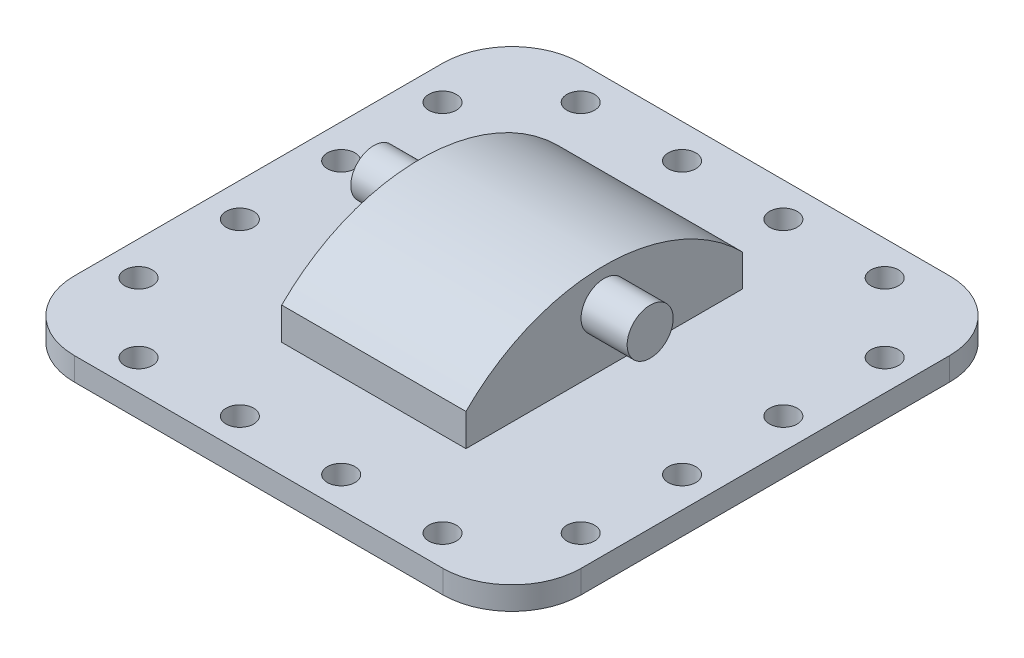
from build123d import *

# Parameters (mm, degrees)
SKETCH1_W                = 110
SKETCH1_H                = 110
BOSS_EXTRUDE1_DEPTH      = 5
FILLET2_R                = 15
FILLET3_R                = 15
FILLET4_R                = 15
FILLET5_R                = 15
SKETCH2_W                = 40
SKETCH2_H                = 60
BOSS_EXTRUDE2_DEPTH      = 24
BOSS_EXTRUDE3_DEPTH      = 10
BOSS_EXTRUDE3_DEPTH_BACK = 50
SKETCH4_R                = 5
FILLET6_R                = 10
FILLET7_R                = 10
SKETCH5_R                = 3
CUT_EXTRUDE1_DEPTH       = 10
CUT_EXTRUDE2_DEPTH       = 60


with BuildPart() as part:
    # Sketch1 → Boss-Extrude1 (new body)
    with BuildSketch(Plane(origin=(0, 0, 0), x_dir=(1, 0, 0), z_dir=(0, 1, 0))):
        Rectangle(SKETCH1_W, SKETCH1_H)
    extrude(amount=BOSS_EXTRUDE1_DEPTH)

    # Fillet2
    fillet2_edges = [part.edges().sort_by_distance(p)[0] for p in [
        (55, 2.5, -55),
    ]]
    fillet(fillet2_edges, radius=FILLET2_R)

    # Fillet3
    fillet3_edges = [part.edges().sort_by_distance(p)[0] for p in [
        (-55, 2.5, -55),
    ]]
    fillet(fillet3_edges, radius=FILLET3_R)

    # Fillet4
    fillet4_edges = [part.edges().sort_by_distance(p)[0] for p in [
        (-55, 2.5, 55),
    ]]
    fillet(fillet4_edges, radius=FILLET4_R)

    # Fillet5
    fillet5_edges = [part.edges().sort_by_distance(p)[0] for p in [
        (55, 2.5, 55),
    ]]
    fillet(fillet5_edges, radius=FILLET5_R)

    # Sketch2 → Boss-Extrude2 (add)
    with BuildSketch(Plane(origin=(0, 5, 0), x_dir=(1, 0, 0), z_dir=(0, 1, 0))):
        Rectangle(SKETCH2_W, SKETCH2_H)
    extrude(amount=BOSS_EXTRUDE2_DEPTH)

    # Sketch4 → Boss-Extrude3 (add, two sides: drawn at the far end of the back side and taken through both)
    with BuildSketch(Plane(origin=(20, 0, 0), x_dir=(0, 0, -1), z_dir=(1, 0, 0)).offset(-BOSS_EXTRUDE3_DEPTH_BACK)):
        with Locations((0, 17)):
            Circle(SKETCH4_R)
    extrude(amount=BOSS_EXTRUDE3_DEPTH + BOSS_EXTRUDE3_DEPTH_BACK)

    # Fillet6
    fillet6_edges = [part.edges().sort_by_distance(p)[0] for p in [
        (0, 29, 30),
    ]]
    fillet(fillet6_edges, radius=FILLET6_R)

    # Fillet7
    fillet7_edges = [part.edges().sort_by_distance(p)[0] for p in [
        (0, 29, -30),
    ]]
    fillet(fillet7_edges, radius=FILLET7_R)

    # Sketch5 → Cut-Extrude1 (cut)
    with BuildSketch(Plane.XZ):
        with Locations((48.334696306, -10.581629618)):
            Circle(SKETCH5_R)
        with Locations((48.334696306, 33.418370382)):
            Circle(SKETCH5_R)
        with Locations((-47.665303694, 11.418370382)):
            Circle(SKETCH5_R)
        with Locations((-47.665303694, -10.581629618)):
            Circle(SKETCH5_R)
        with Locations((-47.665303694, -32.581629618)):
            Circle(SKETCH5_R)
        with Locations((-32.665303694, -47.581629618)):
            Circle(SKETCH5_R)
        with Locations((-10.665303694, -47.581629618)):
            Circle(SKETCH5_R)
        with Locations((11.334696306, -47.581629618)):
            Circle(SKETCH5_R)
        with Locations((33.334696306, -47.581629618)):
            Circle(SKETCH5_R)
        with Locations((48.334696306, -32.581629618)):
            Circle(SKETCH5_R)
        with Locations((48.334696306, 11.418370382)):
            Circle(SKETCH5_R)
        with Locations((33.334696306, 48.418370382)):
            Circle(SKETCH5_R)
        with Locations((11.334696306, 48.418370382)):
            Circle(SKETCH5_R)
        with Locations((-10.665303694, 48.418370382)):
            Circle(SKETCH5_R)
        with Locations((-32.665303694, 48.418370382)):
            Circle(SKETCH5_R)
        with Locations((-47.665303694, 33.418370382)):
            Circle(SKETCH5_R)
    extrude(amount=-CUT_EXTRUDE1_DEPTH, mode=Mode.SUBTRACT)

    # Sketch6 → Cut-Extrude2 (cut)
    with BuildSketch(Plane(origin=(20, 0, 0), x_dir=(0, 0, -1), z_dir=(1, 0, 0))):
        with BuildLine():
            Line((30, 19), (30, 12))
            ThreePointArc((30, 12), (0, 24.426406871), (-30, 12))
            Line((-30, 12), (-30, 19))
            ThreePointArc((-30, 19), (-27.071067812, 26.071067812), (-20, 29))
            Line((-20, 29), (20, 29))
            ThreePointArc((20, 29), (27.071067812, 26.071067812), (30, 19))
        make_face()
    extrude(amount=-CUT_EXTRUDE2_DEPTH, mode=Mode.SUBTRACT)


with BuildPart() as body_2:
    # Split1: the piece on the far side of the plane
    add(part.part)
    split(bisect_by=Plane(origin=(0, 5, 0), x_dir=(0, 0, -1), z_dir=(0, -1, 0)), keep=Keep.BOTTOM)


with BuildPart() as part_1:
    add(part.part)

    # Split1
    split(bisect_by=Plane(origin=(0, 5, 0), x_dir=(0, 0, -1), z_dir=(0, -1, 0)), keep=Keep.TOP)


solid = Compound([body_2.part, part_1.part])
